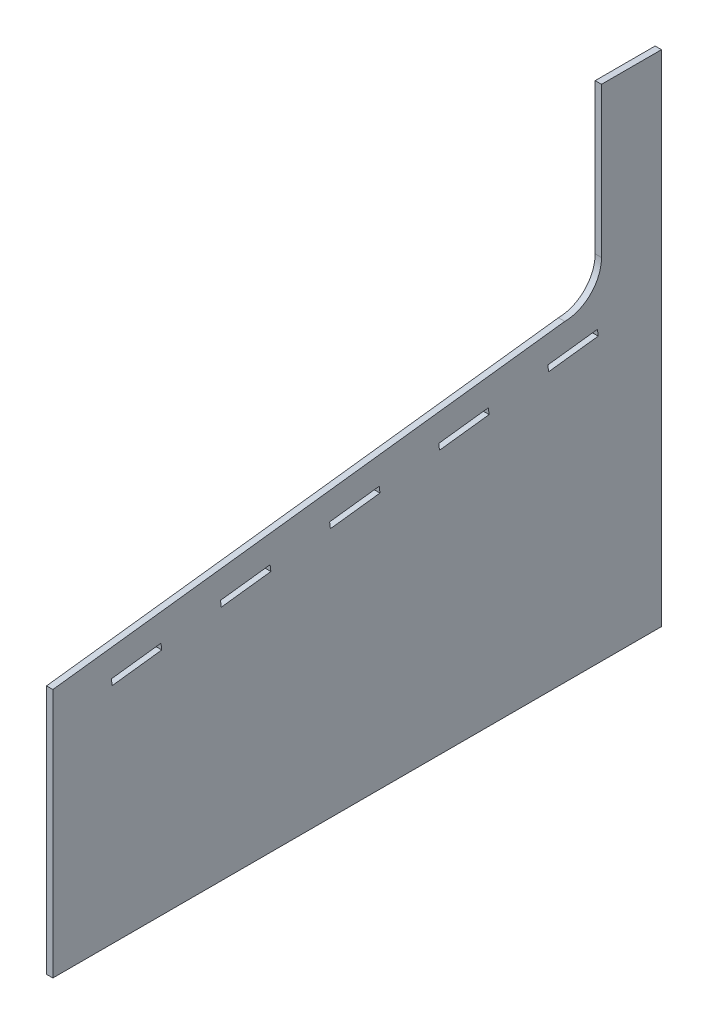
from build123d import *

# Parameters (mm, degrees)
BOSS_EXTRUDE1_DEPTH = 6.35
CUT_EXTRUDE1_DEPTH  = 6.35


with BuildPart() as part:
    # Sketch1 → Boss-Extrude1 (new body)
    with BuildSketch(Plane(origin=(0, 0, 0), x_dir=(0, 0, -1), z_dir=(1, 0, 0))):
        with BuildLine():
            Line((0, 250), (512.262497177, 312.897925783))
            ThreePointArc((512.262497177, 312.897925783), (538.255593647, 323.82701568), (549, 349.896994626))
            Line((549, 349.896994626), (549, 500))
            Line((549, 500), (609, 500))
            Line((609, 500), (609, 250))
            Line((609, 250), (609, 0))
            Line((609, 0), (0, 0))
            Line((0, 0), (0, 250))
        make_face()
    extrude(amount=BOSS_EXTRUDE1_DEPTH)

    # Sketch2 → Cut-Extrude1 (cut)
    with BuildSketch(Plane(origin=(6.35, 0, 0), x_dir=(0, 0, -1), z_dir=(1, 0, 0))):
        Polygon((58.560222947, 229.987525974), (59.334093277, 223.684857911), (108.96140086, 229.778325081), (108.187530529, 236.080993144), align=None)
        Polygon((217.367607209, 249.486620918), (167.740299627, 243.393153748), (168.514169958, 237.090485685), (218.14147754, 243.183952855), align=None)
        Polygon((326.54768389, 262.892248693), (276.920376308, 256.798781523), (277.694246639, 250.49611346), (327.321554221, 256.58958063), align=None)
        Polygon((435.727760571, 276.297876467), (386.100452988, 270.204409297), (386.874323319, 263.901741234), (436.501630901, 269.995208405), align=None)
        Polygon((544.907837251, 289.703504242), (495.280529669, 283.610037072), (496.0544, 277.307369009), (545.681707582, 283.400836179), align=None)
    extrude(amount=-CUT_EXTRUDE1_DEPTH, mode=Mode.SUBTRACT)


solid = part.part
